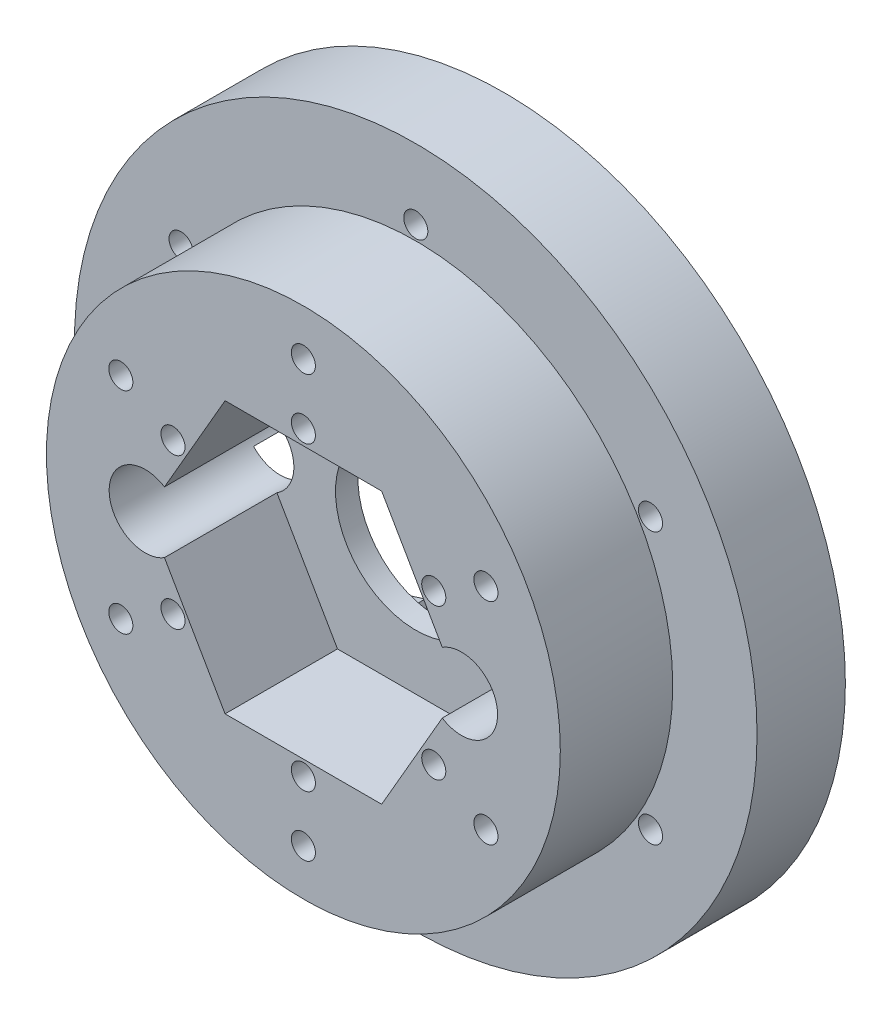
from build123d import *

# Parameters (mm, degrees)
SKETCH1_R               = 17
BOSS_EXTRUDE1_DEPTH     = 4.4
CAVITY1_OUTLINE_R       = 3.15
CAVITY1_DEPTH           = 3.283595969
CAVITY1_START           = 1.183595969
CAVITY1_2_OUTLINE_R     = 3.15
CAVITY1_2_OUTLINE_R_2   = 1.575
CAVITY1_2_DEPTH         = 2.1
SKETCH9_R               = 12.8
BOSS_EXTRUDE3_DEPTH     = 5.6
BOSS_EXTRUDE8_DEPTH     = 8
SKETCH2_R               = 0.6
CUT_EXTRUDE1_DEPTH      = 31.033314835
CIRPATTERN1_COUNT       = 6
CUT_EXTRUDE3_DEPTH      = 31.033314835
CUT_EXTRUDE3_DEPTH_BACK = 4
SKETCH4_R               = 4
SKETCH6_R               = 1.8
CUT_EXTRUDE4_DEPTH      = 31.033314835
FILLET1_START           = 10
FILLET1_DEPTH           = 9
CUT_EXTRUDE5_DEPTH      = 27.038433133
CUT_EXTRUDE5_DEPTH_BACK = 5.6


with BuildPart() as part:
    # Sketch1 → Boss-Extrude1 (new body)
    with BuildSketch(Plane.XY):
        Circle(SKETCH1_R)
    extrude(amount=BOSS_EXTRUDE1_DEPTH)

    # Cavity1: read off the stored shape, not the designer's step
    # Cavity1 outline → Cavity1 (cut)
    with BuildSketch(Plane.XY):
        with BuildLine():
            Line((3.9375, 6.819950055), (2.048148228, 15.163776711))
            ThreePointArc((2.048148228, 15.163776711), (0, 16.8), (-2.048148228, 15.163776711))
            Line((-2.048148228, 15.163776711), (-3.9375, 6.819950055))
            Line((-3.9375, 6.819950055), (-12.108141735, 9.355636751))
            ThreePointArc((-12.108141735, 9.355636751), (-14.549226784, 8.4), (-14.156289963, 5.80813996))
            Line((-14.156289963, 5.80813996), (-7.875, 0))
            Line((-7.875, 0), (-14.156289963, -5.80813996))
            ThreePointArc((-14.156289963, -5.80813996), (-14.549226784, -8.4), (-12.108141735, -9.355636751))
            Line((-12.108141735, -9.355636751), (-3.9375, -6.819950055))
            Line((-3.9375, -6.819950055), (-2.048148228, -15.163776711))
            ThreePointArc((-2.048148228, -15.163776711), (0, -16.8), (2.048148228, -15.163776711))
            Line((2.048148228, -15.163776711), (3.9375, -6.819950055))
            Line((3.9375, -6.819950055), (12.108141735, -9.355636751))
            ThreePointArc((12.108141735, -9.355636751), (14.549226784, -8.4), (14.156289963, -5.80813996))
            Line((14.156289963, -5.80813996), (7.875, 0))
            Line((7.875, 0), (14.156289963, 5.80813996))
            ThreePointArc((14.156289963, 5.80813996), (14.549226784, 8.4), (12.108141735, 9.355636751))
            Line((12.108141735, 9.355636751), (3.9375, 6.819950055))
        make_face()
        Circle(CAVITY1_OUTLINE_R, mode=Mode.SUBTRACT)
    extrude(amount=CAVITY1_DEPTH, mode=Mode.SUBTRACT)

    # Cavity1 2 outline → Cavity1 2 (cut)
    with BuildSketch(Plane.XY.offset(CAVITY1_START)):
        Circle(CAVITY1_2_OUTLINE_R)
        Circle(CAVITY1_2_OUTLINE_R_2, mode=Mode.SUBTRACT)
    extrude(amount=CAVITY1_2_DEPTH, mode=Mode.SUBTRACT)

    # Sketch9 → Boss-Extrude3 (add)
    with BuildSketch(Plane.XY.offset(4.4)):
        Circle(SKETCH9_R)
    extrude(amount=BOSS_EXTRUDE3_DEPTH)

    # Sketch12 → Boss-Extrude8 (add)
    with BuildSketch(Plane.XY.offset(10)):
        Polygon((3.9, -6.75499815), (7.8, 0), (3.9, 6.75499815), (-3.9, 6.75499815), (-7.8, 0), (-3.9, -6.75499815), align=None)
    extrude(amount=BOSS_EXTRUDE8_DEPTH)

    # Sketch2 → Cut-Extrude1 (cut, through all)
    with BuildSketch(Plane(origin=(0, 0, 0), x_dir=(-1, 0, 0), z_dir=(0, 0, -1))):
        with Locations(Location((0, 13.5, 0), (0, 0, 180))):
            Circle(SKETCH2_R)
        with Locations(Location((0, 10.5, 0), (0, 0, 180))):
            Circle(SKETCH2_R)
        with Locations(Location((0, 7.5, 0), (0, 0, 180))):
            Circle(SKETCH2_R)
    cut_extrude1 = extrude(amount=-CUT_EXTRUDE1_DEPTH, mode=Mode.SUBTRACT)

    # CirPattern1: Cut-Extrude1 ×6 about axis
    cirpattern1_axis = Axis((0, 0, 0), (0, 0, 1))
    for i in range(1, CIRPATTERN1_COUNT):
        add(cut_extrude1.rotate(cirpattern1_axis, i * 360 / CIRPATTERN1_COUNT), mode=Mode.SUBTRACT)

    # Sketch4 → Cut-Extrude3 (cut, two sides: drawn at the far end of the back side and taken through both)
    with BuildSketch(Plane.XY.offset(-CUT_EXTRUDE3_DEPTH_BACK)):
        Circle(SKETCH4_R)
    extrude(amount=CUT_EXTRUDE3_DEPTH + CUT_EXTRUDE3_DEPTH_BACK, mode=Mode.SUBTRACT)

    # Sketch6 → Cut-Extrude4 (cut, through all)
    with BuildSketch(Plane(origin=(0, 0, 0), x_dir=(-1, 0, 0), z_dir=(0, 0, -1))):
        with Locations(Location((-7.875, 0, 0), (0, 0, 302.067932294))):
            Circle(SKETCH6_R)
        with Locations(Location((7.875, 0, 0), (0, 0, 42.758730598))):
            Circle(SKETCH6_R)
    extrude(amount=-CUT_EXTRUDE4_DEPTH, mode=Mode.SUBTRACT)

    # Fillet1: read off the stored shape, not the designer's step
    # Fillet1 outline → Fillet1 (cut)
    with BuildSketch(Plane.XY.offset(FILLET1_START)):
        with BuildLine():
            Line((-3.9, 6.75499815), (-6.786751346, 1.75499815))
            add(Edge.make_bspline(
                [(-6.786751346, 1.75499815), (-3.9, 6.75499815), (1.873502692, 6.75499815)],
                knots=[0, 0, 0, 1, 1, 1], degree=2, weights=[1, 9, 1]))
            Line((1.873502692, 6.75499815), (-3.9, 6.75499815))
        make_face()
    extrude(amount=FILLET1_DEPTH, mode=Mode.SUBTRACT)

    # Sketch12<4> → Cut-Extrude5 (cut, two sides: drawn at the far end of the back side and taken through both)
    with BuildSketch(Plane.XY.offset(10).offset(-CUT_EXTRUDE5_DEPTH_BACK)):
        Polygon((3.9, -6.75499815), (7.8, 0), (3.9, 6.75499815), (-3.9, 6.75499815), (-7.8, 0), (-3.9, -6.75499815), align=None)
    extrude(amount=CUT_EXTRUDE5_DEPTH + CUT_EXTRUDE5_DEPTH_BACK, mode=Mode.SUBTRACT)


solid = part.part
